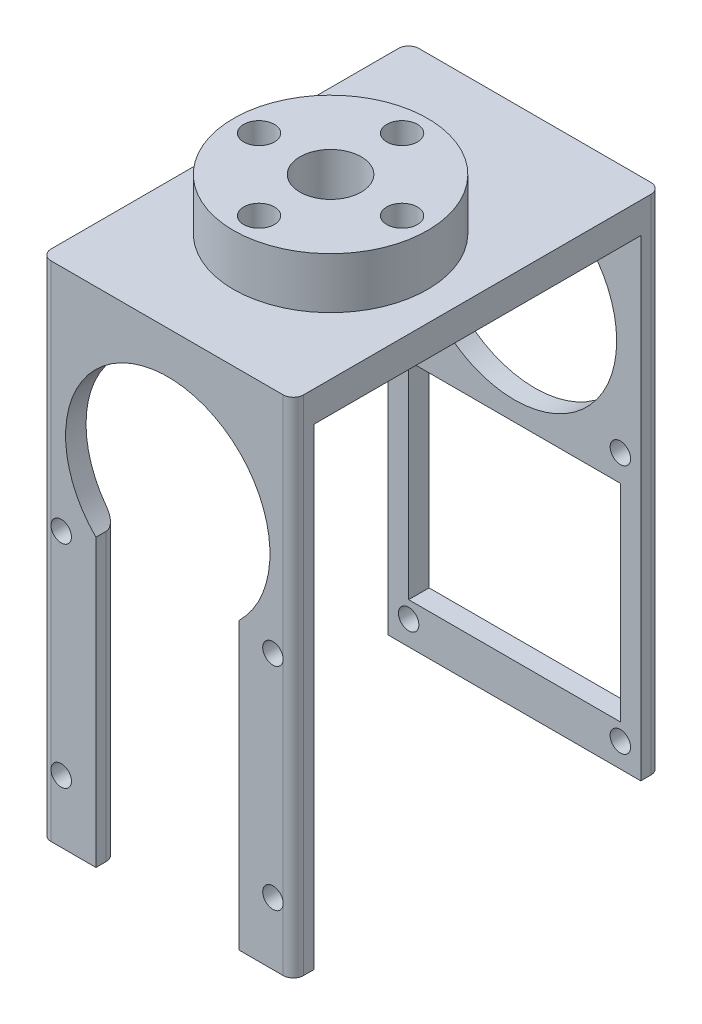
from build123d import *

# Parameters (mm, degrees)
SKETCH_1_W          = 24.72
SKETCH_1_H          = 49.22
EXTRUDE_1_DEPTH     = 36
SKETCH_3_W          = 24.72
SKETCH_3_H          = 32
CUT_EXTRUDE_1_DEPTH = 46.22
SKETCH_4_R          = 1
SKETCH_4_R_2        = 10
SKETCH_4_W          = 20.72
SKETCH_4_H          = 20.22
CUT_EXTRUDE_2_DEPTH = 2
SKETCH_6_R          = 1
CUT_EXTRUDE_3_DEPTH = 6
SKETCH_7_R          = 9.5
EXTRUDE_2_DEPTH     = 5
SKETCH_8_R          = 1.5
CUT_EXTRUDE_4_DEPTH = 8
FILLET_5_R          = 1
FILLET_6_R          = 1
FILLET_7_R          = 1
FILLET_8_R          = 1
FILLET_9_R          = 1
FILLET_10_R         = 1
SKETCH_9_R          = 3
CUT_EXTRUDE_5_DEPTH = 10
SKETCH_10_R         = 3
CUT_EXTRUDE_6_DEPTH = 2


with BuildPart() as part:
    # 草图1 → 凸台-拉伸1 (new body)
    with BuildSketch(Plane.XY):
        with Locations((12.36, 24.61)):
            Rectangle(SKETCH_1_W, SKETCH_1_H)
    extrude(amount=EXTRUDE_1_DEPTH)

    # 草图3 → 切除-拉伸1 (cut)
    with BuildSketch(Plane.XZ):
        with Locations((12.36, 18)):
            Rectangle(SKETCH_3_W, SKETCH_3_H)
    extrude(amount=-CUT_EXTRUDE_1_DEPTH, mode=Mode.SUBTRACT)

    # 草图4 → 切除-拉伸2 (cut)
    with BuildSketch(Plane.XY.offset(2)):
        with Locations((2, 2.36)):
            Circle(SKETCH_4_R)
        with Locations((22.72, 2.36)):
            Circle(SKETCH_4_R)
        with Locations((22.72, 26.81)):
            Circle(SKETCH_4_R)
        with Locations((2, 26.81)):
            Circle(SKETCH_4_R)
        with Locations((12.36, 36.11)):
            Circle(SKETCH_4_R_2)
        with Locations((12.36, 14.11)):
            Rectangle(SKETCH_4_W, SKETCH_4_H)
    extrude(amount=-CUT_EXTRUDE_2_DEPTH, mode=Mode.SUBTRACT)

    # 草图6 → 切除-拉伸3 (cut)
    with BuildSketch(Plane.XY.offset(36)):
        with BuildLine():
            Line((5.4, 27.996527822), (5.4, 28))
            Line((5.4, 28), (19.4, 28))
            Line((19.4, 28), (19.4, 27.940836898))
            ThreePointArc((19.4, 27.940836898), (21.640245754, 31.218722824), (22.428407613, 35.11))
            ThreePointArc((22.428407613, 35.11), (8.573804918, 44.337244337), (5.4, 27.996527822))
        make_face()
        with BuildLine():
            Line((19.4, 28), (5.4, 28))
            Line((5.4, 28), (5.4, 27.996527822))
            ThreePointArc((5.4, 27.996527822), (12.388628696, 25.110079118), (19.4, 27.940836898))
            Line((19.4, 27.940836898), (19.4, 28))
        make_face()
        with BuildLine():
            ThreePointArc((19.4, 27.940836898), (12.388628696, 25.110079118), (5.4, 27.996527822))
            Line((5.4, 27.996527822), (5.4, 0))
            Line((5.4, 0), (19.4, 0))
            Line((19.4, 0), (19.4, 27.940836898))
        make_face()
        with Locations((2, 26.81)):
            Circle(SKETCH_6_R)
        with Locations((22.72, 6.11)):
            Circle(SKETCH_6_R)
        with Locations((2, 6.11)):
            Circle(SKETCH_6_R)
        with Locations((22.72, 26.81)):
            Circle(SKETCH_6_R)
    extrude(amount=-CUT_EXTRUDE_3_DEPTH, mode=Mode.SUBTRACT)

    # 草图7 → 凸台-拉伸2 (add)
    with BuildSketch(Plane(origin=(0, 49.22, 0), x_dir=(1, 0, 0), z_dir=(0, 1, 0))):
        with Locations(Location((12.36, -20, 0), (0, 0, 270))):
            Circle(SKETCH_7_R)
    extrude(amount=EXTRUDE_2_DEPTH)

    # 草图8 → 切除-拉伸4 (cut)
    with BuildSketch(Plane(origin=(0, 54.22, 0), x_dir=(1, 0, 0), z_dir=(0, 1, 0))):
        with Locations(Location((12.36, -13, 0), (0, 0, 270))):
            Circle(SKETCH_8_R)
        with Locations(Location((12.36, -27, 0), (0, 0, 270))):
            Circle(SKETCH_8_R)
        with Locations(Location((19.36, -20, 0), (0, 0, 270))):
            Circle(SKETCH_8_R)
        with Locations(Location((5.36, -20, 0), (0, 0, 270))):
            Circle(SKETCH_8_R)
    extrude(amount=-CUT_EXTRUDE_4_DEPTH, mode=Mode.SUBTRACT)

    # 圆角5
    fillet_5_edges = [part.edges().sort_by_distance(p)[0] for p in [
        (0, 24.61, 36),
    ]]
    fillet(fillet_5_edges, radius=FILLET_5_R - 0.0001)  # a hair under: the kernel refuses the full size

    # 圆角6
    fillet_6_edges = [part.edges().sort_by_distance(p)[0] for p in [
        (24.72, 24.61, 36),
    ]]
    fillet(fillet_6_edges, radius=FILLET_6_R - 0.0001)  # a hair under: the kernel refuses the full size

    # 圆角7
    fillet_7_edges = [part.edges().sort_by_distance(p)[0] for p in [
        (0, 24.61, 0),
    ]]
    fillet(fillet_7_edges, radius=FILLET_7_R - 0.0001)  # a hair under: the kernel refuses the full size

    # 圆角8
    fillet_8_edges = [part.edges().sort_by_distance(p)[0] for p in [
        (24.72, 24.61, 0),
    ]]
    fillet(fillet_8_edges, radius=FILLET_8_R - 0.0001)  # a hair under: the kernel refuses the full size

    # 圆角9
    fillet_9_edges = [part.edges().sort_by_distance(p)[0] for p in [
        (19.4, 13.970418449, 34),
    ]]
    fillet(fillet_9_edges, radius=FILLET_9_R)

    # 圆角10
    fillet_10_edges = [part.edges().sort_by_distance(p)[0] for p in [
        (5.4, 13.998263911, 34),
    ]]
    fillet(fillet_10_edges, radius=FILLET_10_R)

    # 草图9 → 切除-拉伸5 (cut)
    with BuildSketch(Plane(origin=(0, 54.22, 0), x_dir=(1, 0, 0), z_dir=(0, 1, 0))):
        with Locations(Location((12.36, -20, 0), (0, 0, 270))):
            Circle(SKETCH_9_R)
    extrude(amount=-CUT_EXTRUDE_5_DEPTH, mode=Mode.SUBTRACT)

    # 草图10 → 切除-拉伸6 (cut)
    with BuildSketch(Plane.XZ.offset(-46.22)):
        with Locations(Location((12.36, 27, 0), (0, 0, 270))):
            Circle(SKETCH_10_R)
        with Locations(Location((5.36, 20, 0), (0, 0, 270))):
            Circle(SKETCH_10_R)
        with Locations(Location((12.36, 13, 0), (0, 0, 270))):
            Circle(SKETCH_10_R)
        with Locations(Location((19.36, 20, 0), (0, 0, 270))):
            Circle(SKETCH_10_R)
    extrude(amount=-CUT_EXTRUDE_6_DEPTH, mode=Mode.SUBTRACT)


solid = part.part
